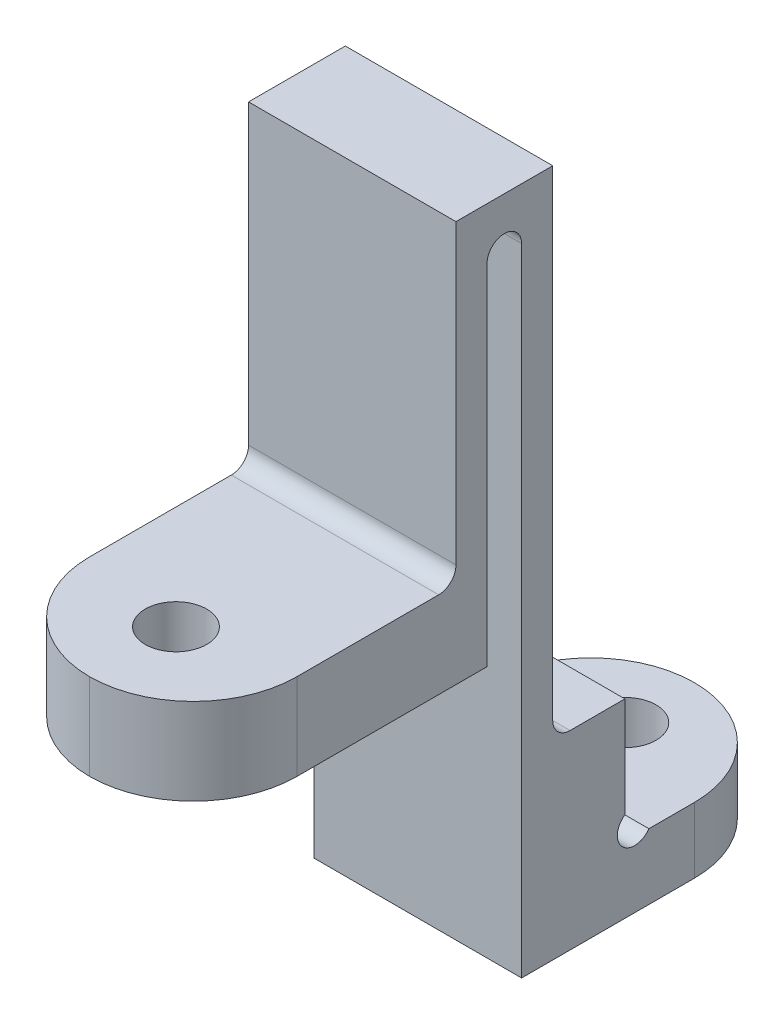
from build123d import *

# Parameters (mm, degrees)
BOSS_EXTRUDE1_DEPTH   = 6
SKETCH3_W             = 7.6
SKETCH3_H             = 7.1
SKETCH3_H_2           = 14.9
CUT_EXTRUDE2_DEPTH    = 21.860671783
SKETCH4_W             = 7.6
SKETCH4_H             = 2.5
SKETCH4_W_2           = 5.5
SKETCH4_H_2           = 3.6
CUT_EXTRUDE3_DEPTH    = 21.860671783
FILLET2_R             = 3
F_2_56_TAPPED_HOLE1_D = 1.778
FILLET3_R             = 0.5
F_2_56_TAPPED_HOLE2_D = 1.778
SKETCH19_R            = 0.5
CUT_EXTRUDE6_DEPTH    = 21.860671783


with BuildPart() as part:
    # Sketch1 → Boss-Extrude1 (new body)
    with BuildSketch(Plane(origin=(7.5, 0, 0), x_dir=(0, 0, -1), z_dir=(1, 0, 0))):
        with BuildLine():
            Line((-10.5, 16.997577099), (-10.5, 5.397577099))
            Line((-10.5, 5.397577099), (-2, 5.397577099))
            Line((-2, 5.397577099), (-2, 15.497577099))
            ThreePointArc((-2, 15.497577099), (-1.5, 15.997577099), (-1, 15.497577099))
            Line((-1, 15.497577099), (-1, -2.902422901))
            Line((-1, -2.902422901), (7, -2.902422901))
            Line((7, -2.902422901), (7, 16.997577099))
            Line((7, 16.997577099), (-10.5, 16.997577099))
        make_face()
    extrude(amount=-BOSS_EXTRUDE1_DEPTH)

    # Sketch3 → Cut-Extrude2 (cut, through all)
    with BuildSketch(Plane.ZY.offset(-1.5)):
        with Locations((6.7, 13.947577099)):
            Rectangle(SKETCH3_W, SKETCH3_H)
        with Locations((-3.7, 10.047577099)):
            Rectangle(SKETCH3_W, SKETCH3_H_2)
    extrude(amount=-CUT_EXTRUDE2_DEPTH, mode=Mode.SUBTRACT)

    # Sketch4 → Cut-Extrude3 (cut, through all)
    with BuildSketch(Plane.ZY.offset(-1.5)):
        with Locations((6.7, 9.147577099)):
            Rectangle(SKETCH4_W, SKETCH4_H)
        with Locations((-4.736302331, 0.797577099)):
            Rectangle(SKETCH4_W_2, SKETCH4_H_2)
    extrude(amount=-CUT_EXTRUDE3_DEPTH, mode=Mode.SUBTRACT)

    # Fillet2
    fillet2_edges = [part.edges().sort_by_distance(p)[0] for p in [
        (1.5, 6.647577099, 10.5),
        (7.5, 6.647577099, 10.5),
        (7.5, -1.952422901, -7),
        (1.5, -1.952422901, -7),
    ]]
    fillet(fillet2_edges, radius=FILLET2_R - 0.0001)  # a hair under: the kernel refuses the full size

    # #2-56 Tapped Hole1 (through all)
    with Locations(Plane(origin=(0, 7.897577099, 0), x_dir=(1, 0, 0), z_dir=(0, 1, 0))):
        with Locations((4.5, -8)):
            Hole(F_2_56_TAPPED_HOLE1_D / 2)

    # Fillet3
    fillet3_edges = [part.edges().sort_by_distance(p)[0] for p in [
        (4.5, 2.597577099, 0.1),
        (4.5, 7.897577099, 2.9),
    ]]
    fillet(fillet3_edges, radius=FILLET3_R)

    # #2-56 Tapped Hole2 (through all)
    with Locations(Plane(origin=(0, -1.002422901, 0), x_dir=(1, 0, 0), z_dir=(0, 1, 0))):
        with Locations((4.5, 5)):
            Hole(F_2_56_TAPPED_HOLE2_D / 2)

    # Sketch19 → Cut-Extrude6 (cut, through all)
    with BuildSketch(Plane(origin=(7.5, 0, 0), x_dir=(0, 0, -1), z_dir=(1, 0, 0))):
        with Locations((2.269145043, -0.719580189)):
            Circle(SKETCH19_R)
    extrude(amount=-CUT_EXTRUDE6_DEPTH, mode=Mode.SUBTRACT)


solid = part.part
